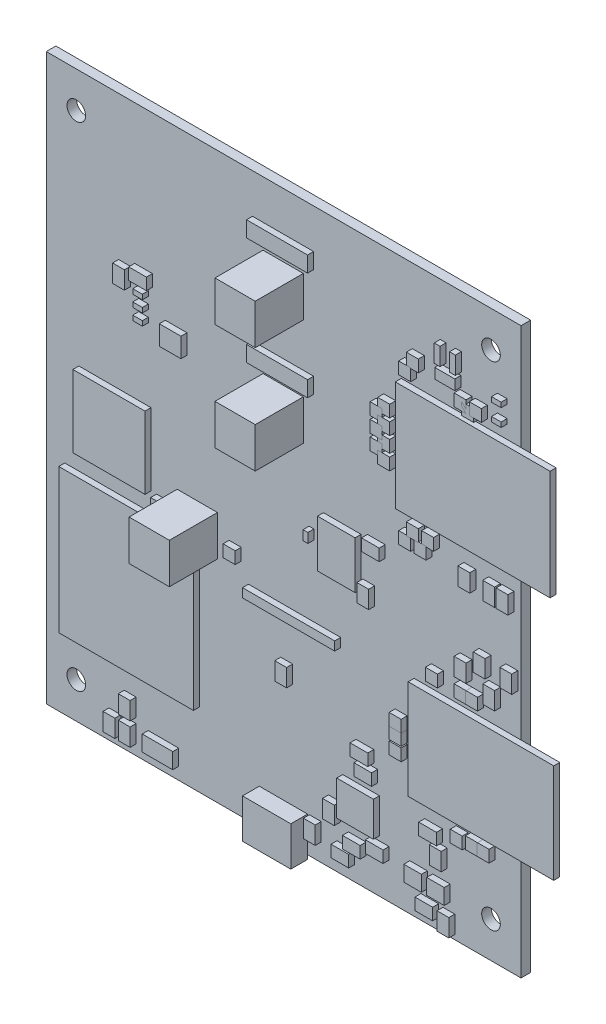
from build123d import *

# Parameters (mm, degrees)
SKETCH1_W                     = 79
SKETCH1_H                     = 94
BOARD_DEPTH                   = 1.6
SKETCH2_W                     = 22.4041
SKETCH2_H                     = 23.9616
BATTCOM_20MM_PTH_KIT_1_DEPTH  = 1
SKETCH3_W                     = 1.6
SKETCH3_H                     = 0.8008
C0603K_1_DEPTH                = 1
SKETCH4_W                     = 0.8008
SKETCH4_H                     = 1.6
C0603K_2_DEPTH                = 1
SKETCH5_W                     = 0.8008
SKETCH5_H                     = 1.6
C0603K_3_DEPTH                = 1
SKETCH6_W                     = 0.8008
SKETCH6_H                     = 1.6
C0603K_4_DEPTH                = 1
SKETCH7_W                     = 0.8008
SKETCH7_H                     = 1.6
C0603K_5_DEPTH                = 1
SKETCH8_W                     = 1.6
SKETCH8_H                     = 0.8008
C0603K_6_DEPTH                = 1
SKETCH9_W                     = 0.966
SKETCH9_H                     = 2.946
EXTRUDE_C0402_1_DEPTH         = 1
SKETCH10_W                    = 0.966
SKETCH10_H                    = 2.946
EXTRUDE_C0402_2_DEPTH         = 1
SKETCH11_W                    = 1.6
SKETCH11_H                    = 0.8008
C0603K_7_DEPTH                = 1
SKETCH12_W                    = 0.8008
SKETCH12_H                    = 1.6
C0603K_8_DEPTH                = 1
SKETCH13_W                    = 0.8008
SKETCH13_H                    = 1.6
C0603K_9_DEPTH                = 1
SKETCH14_W                    = 0.8008
SKETCH14_H                    = 1.6
C0603K_10_DEPTH               = 1
SKETCH15_W                    = 1.6
SKETCH15_H                    = 0.8008
C0603K_11_DEPTH               = 1
SKETCH16_W                    = 6.7016
SKETCH16_H                    = 6.7016
F_153CLV_0605_1_DEPTH         = 8
SKETCH17_W                    = 6.7016
SKETCH17_H                    = 6.7016
F_153CLV_0605_2_DEPTH         = 8
SKETCH18_W                    = 1.6
SKETCH18_H                    = 0.8008
C0603K_12_DEPTH               = 1
SKETCH19_W                    = 0.8008
SKETCH19_H                    = 1.6
C0603K_13_DEPTH               = 1
SKETCH20_W                    = 0.8008
SKETCH20_H                    = 1.6
C0603K_14_DEPTH               = 1
SKETCH21_W                    = 1.6
SKETCH21_H                    = 0.8008
C0603K_15_DEPTH               = 1
SKETCH22_W                    = 0.8008
SKETCH22_H                    = 1.6
C0603K_16_DEPTH               = 1
SKETCH23_W                    = 1.6
SKETCH23_H                    = 0.8008
C0603K_17_DEPTH               = 1
SKETCH24_W                    = 0.8008
SKETCH24_H                    = 1.6
C0603K_18_DEPTH               = 1
SKETCH25_W                    = 6.7016
SKETCH25_H                    = 6.7016
F_153CLV_0605_3_DEPTH         = 8
SKETCH26_W                    = 1.6
SKETCH26_H                    = 0.8008
C0603K_19_DEPTH               = 1
SKETCH27_W                    = 1.6
SKETCH27_H                    = 0.8008
C0603K_20_DEPTH               = 1
SKETCH28_W                    = 1.6
SKETCH28_H                    = 0.8008
C0603K_21_DEPTH               = 1
SKETCH29_W                    = 1.6
SKETCH29_H                    = 0.8008
C0603K_22_DEPTH               = 1
SKETCH30_W                    = 1.6
SKETCH30_H                    = 0.8008
C0603K_23_DEPTH               = 1
SKETCH31_W                    = 0.966
SKETCH31_H                    = 2.946
EXTRUDE_C0402_3_DEPTH         = 1
SKETCH32_W                    = 0.966
SKETCH32_H                    = 2.946
EXTRUDE_C0402_4_DEPTH         = 1
SKETCH33_W                    = 0.8008
SKETCH33_H                    = 1.6
C0603K_24_DEPTH               = 1
SKETCH34_W                    = 5.6242
SKETCH34_H                    = 5.676903
WS2812B_1_DEPTH               = 1
SKETCH35_W                    = 2.921
SKETCH35_H                    = 2.5908
SOT23_1_DEPTH                 = 1
SKETCH36_W                    = 2.921
SKETCH36_H                    = 2.5908
SOT23_2_DEPTH                 = 1
SKETCH37_W                    = 6.10435
SKETCH37_H                    = 5.77935
MLP28_1_DEPTH                 = 1
SKETCH38_W                    = 2.2
SKETCH38_H                    = 2.4032
SC70_5L_1_DEPTH               = 1
SKETCH39_W                    = 15.3416
SKETCH39_H                    = 1.4732
F_1X06_LONGPADS_1_DEPTH       = 1
SKETCH40_W                    = 8.04
SKETCH40_H                    = 6.534
USB_MICROB_PTH_MILL_1_DEPTH   = 2.8
SKETCH41_W                    = 2.9914
SKETCH41_H                    = 4.9968
L3225M_1_DEPTH                = 1
SKETCH42_W                    = 10.16
SKETCH42_H                    = 2.6162
EXTRUDE_1X04_1_DEPTH          = 1
SKETCH43_W                    = 10.16
SKETCH43_H                    = 2.6162
EXTRUDE_1X04_2_DEPTH          = 1
SKETCH44_W                    = 5.08
SKETCH44_H                    = 2.6162
EXTRUDE_1X02_1_DEPTH          = 1
SKETCH45_W                    = 12.0032
SKETCH45_H                    = 12.0032
BUZZER_12MM_NS_KIT_1_DEPTH    = 1
SKETCH46_W                    = 1.966
SKETCH46_H                    = 2.946
EXTRUDE_R0603_1_DEPTH         = 1
SKETCH47_W                    = 2.946
SKETCH47_H                    = 1.966
EXTRUDE_R0603_2_DEPTH         = 1
SKETCH48_W                    = 2.946
SKETCH48_H                    = 1.966
EXTRUDE_R0603_3_DEPTH         = 1
SKETCH49_W                    = 2.946
SKETCH49_H                    = 1.966
EXTRUDE_R0603_4_DEPTH         = 1
SKETCH50_W                    = 2.946
SKETCH50_H                    = 1.966
EXTRUDE_R0603_5_DEPTH         = 1
SKETCH51_W                    = 2.946
SKETCH51_H                    = 1.966
EXTRUDE_R0603_6_DEPTH         = 1
SKETCH52_W                    = 2.946
SKETCH52_H                    = 1.966
EXTRUDE_R0603_7_DEPTH         = 1
SKETCH53_W                    = 1.966
SKETCH53_H                    = 2.946
EXTRUDE_R0603_8_DEPTH         = 1
SKETCH54_W                    = 1.966
SKETCH54_H                    = 2.946
EXTRUDE_R0603_9_DEPTH         = 1
SKETCH55_W                    = 2.946
SKETCH55_H                    = 1.966
EXTRUDE_R0603_10_DEPTH        = 1
SKETCH56_W                    = 1.966
SKETCH56_H                    = 2.946
EXTRUDE_R0603_11_DEPTH        = 1
SKETCH57_W                    = 1.966
SKETCH57_H                    = 2.946
EXTRUDE_R0603_12_DEPTH        = 1
SKETCH58_W                    = 1.966
SKETCH58_H                    = 2.946
EXTRUDE_R0603_13_DEPTH        = 1
SKETCH59_W                    = 1.966
SKETCH59_H                    = 2.946
EXTRUDE_R0603_14_DEPTH        = 1
SKETCH60_W                    = 1.966
SKETCH60_H                    = 2.946
EXTRUDE_R0603_15_DEPTH        = 1
SKETCH61_W                    = 2.946
SKETCH61_H                    = 1.966
EXTRUDE_R0603_16_DEPTH        = 1
SKETCH62_W                    = 2.946
SKETCH62_H                    = 1.966
EXTRUDE_R0603_17_DEPTH        = 1
SKETCH63_W                    = 1.966
SKETCH63_H                    = 2.946
EXTRUDE_R0603_18_DEPTH        = 1
SKETCH64_W                    = 1.966
SKETCH64_H                    = 2.946
EXTRUDE_R0603_19_DEPTH        = 1
SKETCH65_W                    = 1.966
SKETCH65_H                    = 2.946
EXTRUDE_R0603_20_DEPTH        = 1
SKETCH66_W                    = 1.966
SKETCH66_H                    = 2.946
EXTRUDE_R0603_21_DEPTH        = 1
SKETCH67_W                    = 1.966
SKETCH67_H                    = 2.946
EXTRUDE_R0603_22_DEPTH        = 1
SKETCH68_W                    = 1.966
SKETCH68_H                    = 2.946
EXTRUDE_R0603_23_DEPTH        = 1
SKETCH69_W                    = 1.966
SKETCH69_H                    = 2.946
EXTRUDE_R0603_24_DEPTH        = 1
SKETCH70_W                    = 1.966
SKETCH70_H                    = 2.946
EXTRUDE_R0603_25_DEPTH        = 1
SKETCH71_W                    = 1.966
SKETCH71_H                    = 2.946
EXTRUDE_R0603_26_DEPTH        = 1
SKETCH72_W                    = 2.946
SKETCH72_H                    = 1.966
EXTRUDE_R0603_27_DEPTH        = 1
SKETCH73_W                    = 2.946
SKETCH73_H                    = 1.966
EXTRUDE_R0603_28_DEPTH        = 1
SKETCH74_W                    = 2.946
SKETCH74_H                    = 1.966
EXTRUDE_R0603_29_DEPTH        = 1
SKETCH75_W                    = 2.946
SKETCH75_H                    = 1.966
EXTRUDE_R0603_30_DEPTH        = 1
SKETCH76_W                    = 1.966
SKETCH76_H                    = 2.946
EXTRUDE_R0603_31_DEPTH        = 1
SKETCH77_W                    = 2.946
SKETCH77_H                    = 1.966
EXTRUDE_R0603_32_DEPTH        = 1
SKETCH78_W                    = 2.946
SKETCH78_H                    = 1.966
EXTRUDE_R0603_33_DEPTH        = 1
SKETCH79_W                    = 1.966
SKETCH79_H                    = 2.946
EXTRUDE_R0603_34_DEPTH        = 1
SKETCH80_W                    = 1.966
SKETCH80_H                    = 2.946
EXTRUDE_R0603_35_DEPTH        = 1
SKETCH81_W                    = 2.946
SKETCH81_H                    = 1.966
EXTRUDE_R0603_36_DEPTH        = 1
SKETCH82_W                    = 1.966
SKETCH82_H                    = 2.946
EXTRUDE_R0603_37_DEPTH        = 1
SKETCH83_W                    = 1.966
SKETCH83_H                    = 2.946
EXTRUDE_R0603_38_DEPTH        = 1
SKETCH84_W                    = 2.946
SKETCH84_H                    = 1.966
EXTRUDE_R0603_39_DEPTH        = 1
SKETCH85_W                    = 2.946
SKETCH85_H                    = 1.966
EXTRUDE_R0603_40_DEPTH        = 1
SKETCH86_W                    = 1.966
SKETCH86_H                    = 2.946
EXTRUDE_R0603_41_DEPTH        = 1
SKETCH87_W                    = 1.966
SKETCH87_H                    = 2.946
EXTRUDE_R0603_42_DEPTH        = 1
SKETCH88_W                    = 2.946
SKETCH88_H                    = 1.966
EXTRUDE_R0603_43_DEPTH        = 1
SKETCH89_W                    = 2.946
SKETCH89_H                    = 1.966
EXTRUDE_R0603_44_DEPTH        = 1
SKETCH90_W                    = 1.966
SKETCH90_H                    = 2.946
EXTRUDE_R0603_45_DEPTH        = 1
SKETCH91_W                    = 2.946
SKETCH91_H                    = 1.966
EXTRUDE_R0603_46_DEPTH        = 1
SKETCH92_W                    = 2.946
SKETCH92_H                    = 1.966
EXTRUDE_R0603_47_DEPTH        = 1
SKETCH93_W                    = 2.946
SKETCH93_H                    = 1.966
EXTRUDE_R0603_48_DEPTH        = 1
SKETCH94_W                    = 1.966
SKETCH94_H                    = 2.946
EXTRUDE_R0603_49_DEPTH        = 1
SKETCH95_W                    = 1.966
SKETCH95_H                    = 2.946
EXTRUDE_R0603_50_DEPTH        = 1
SKETCH96_W                    = 1.966
SKETCH96_H                    = 2.946
EXTRUDE_R0603_51_DEPTH        = 1
SKETCH97_W                    = 1.966
SKETCH97_H                    = 2.946
EXTRUDE_R0603_52_DEPTH        = 1
SKETCH98_W                    = 1.966
SKETCH98_H                    = 2.946
EXTRUDE_R0603_53_DEPTH        = 1
SKETCH99_W                    = 1.966
SKETCH99_H                    = 2.946
EXTRUDE_R0603_54_DEPTH        = 1
SKETCH100_W                   = 24.227
SKETCH100_H                   = 16.51
ESP8266_ESP12E_1_DEPTH        = 1
SKETCH101_W                   = 2.921
SKETCH101_H                   = 2.5908
SOT23_3_DEPTH                 = 1
SKETCH102_W                   = 2.921
SKETCH102_H                   = 2.5908
SOT23_4_DEPTH                 = 1
SKETCH103_W                   = 2.921
SKETCH103_H                   = 2.5908
SOT23_5_DEPTH                 = 1
SKETCH104_W                   = 2
SKETCH104_H                   = 2
TP10R_1_DEPTH                 = 1
SKETCH105_W                   = 2
SKETCH105_H                   = 2
TP10R_2_DEPTH                 = 1
SKETCH106_W                   = 2
SKETCH106_H                   = 2
TP10R_3_DEPTH                 = 1
SKETCH107_W                   = 2
SKETCH107_H                   = 2
TP10R_4_DEPTH                 = 1
SKETCH108_W                   = 2
SKETCH108_H                   = 2
TP10R_5_DEPTH                 = 1
SKETCH109_W                   = 2
SKETCH109_H                   = 2
TP10R_6_DEPTH                 = 1
SKETCH110_W                   = 2
SKETCH110_H                   = 2
TP10R_7_DEPTH                 = 1
SKETCH111_W                   = 2
SKETCH111_H                   = 2
TP10R_8_DEPTH                 = 1
SKETCH112_W                   = 2
SKETCH112_H                   = 2
TP10R_9_DEPTH                 = 1
SKETCH113_W                   = 2
SKETCH113_H                   = 2
TP10R_10_DEPTH                = 1
SKETCH114_W                   = 2
SKETCH114_H                   = 2
TP10R_11_DEPTH                = 1
SKETCH115_W                   = 2
SKETCH115_H                   = 2
TP10R_12_DEPTH                = 1
SKETCH116_W                   = 2
SKETCH116_H                   = 2
TP10R_13_DEPTH                = 1
SKETCH117_W                   = 2
SKETCH117_H                   = 2
TP10R_14_DEPTH                = 1
SKETCH118_W                   = 2
SKETCH118_H                   = 2
TP10R_15_DEPTH                = 1
SKETCH119_W                   = 2
SKETCH119_H                   = 2
TP10R_16_DEPTH                = 1
SKETCH120_W                   = 2
SKETCH120_H                   = 2
TP10R_17_DEPTH                = 1
SKETCH121_W                   = 2
SKETCH121_H                   = 2
TP10R_18_DEPTH                = 1
SKETCH122_W                   = 2
SKETCH122_H                   = 2
TP10R_19_DEPTH                = 1
SKETCH123_W                   = 2
SKETCH123_H                   = 2
TP10R_20_DEPTH                = 1
SKETCH124_W                   = 2
SKETCH124_H                   = 2
TP10R_21_DEPTH                = 1
SKETCH125_W                   = 2
SKETCH125_H                   = 2
TP10R_22_DEPTH                = 1
SKETCH126_W                   = 2
SKETCH126_H                   = 2
TP10R_23_DEPTH                = 1
SKETCH127_W                   = 2
SKETCH127_H                   = 2
TP10R_24_DEPTH                = 1
SKETCH128_W                   = 2
SKETCH128_H                   = 2
TP10R_25_DEPTH                = 1
SKETCH129_W                   = 2
SKETCH129_H                   = 2
TP10R_26_DEPTH                = 1
SKETCH130_W                   = 2
SKETCH130_H                   = 2
TP10R_27_DEPTH                = 1
SKETCH131_W                   = 3
SKETCH131_H                   = 2.9464
SOT23_5_1_DEPTH               = 1
SKETCH132_W                   = 5.715
SKETCH132_H                   = 6.1976
SO08_0_15_1_DEPTH             = 1
SKETCH133_W                   = 25.754
SKETCH133_H                   = 18.254
ESP_WROOM_32_1_DEPTH          = 1
SKETCH134_W                   = 11.230556
SKETCH134_H                   = 6.6675
SO016_1_DEPTH                 = 1
SKETCH135_W                   = 6.261
SKETCH135_H                   = 7.9
SOIC_8_1_DEPTH                = 1
SKETCH136_W                   = 3.5889
SKETCH136_H                   = 3.2524
QFN_16_0_5MM_EXTRA_1_DEPTH    = 1
SKETCH137_W                   = 6.096
SKETCH137_H                   = 13.208
HC49UP_1_DEPTH                = 1
SKETCH138_W                   = 3.327
SKETCH138_H                   = 1.7
CRYSTAL_SMD_3_2X1_5MM_1_DEPTH = 1
SKETCH139_W                   = 3.327
SKETCH139_H                   = 1.7
CRYSTAL_SMD_3_2X1_5MM_2_DEPTH = 1
SKETCH140_R                   = 1.55
CUT_EXTRUDE1_DEPTH            = 10


with BuildPart() as part:
    # Sketch1 → BOARD (new body)
    with BuildSketch(Plane.XY):
        with Locations((39.5, 47)):
            Rectangle(SKETCH1_W, SKETCH1_H)
    extrude(amount=BOARD_DEPTH)

    # Sketch140 → Cut-Extrude1 (cut)
    with BuildSketch(Plane.XY.offset(1.6)):
        with Locations((5, 6)):
            Circle(SKETCH140_R)
        with Locations((5, 88)):
            Circle(SKETCH140_R)
        with Locations((74, 6)):
            Circle(SKETCH140_R)
        with Locations((74, 88)):
            Circle(SKETCH140_R)
    extrude(amount=-CUT_EXTRUDE1_DEPTH, mode=Mode.SUBTRACT)


with BuildPart() as body_2:
    # Sketch2 → BATTCOM_20MM_PTH_KIT-1 (new body)
    with BuildSketch(Plane.XY.offset(1.6)):
        with Locations((14.2875, 24.2767)):
            Rectangle(SKETCH2_W, SKETCH2_H)
    extrude(amount=BATTCOM_20MM_PTH_KIT_1_DEPTH)


with BuildPart() as body_3:
    # Sketch3 → C0603K-1 (new body)
    with BuildSketch(Plane.XY):
        with Locations((38.1, 43.1804)):
            Rectangle(SKETCH3_W, SKETCH3_H)
    extrude(amount=-C0603K_1_DEPTH)


with BuildPart() as body_4:
    # Sketch4 → C0603K-2 (new body)
    with BuildSketch(Plane.XY):
        with Locations((34.9254, 24.765)):
            Rectangle(SKETCH4_W, SKETCH4_H)
    extrude(amount=-C0603K_2_DEPTH)


with BuildPart() as body_5:
    # Sketch5 → C0603K-3 (new body)
    with BuildSketch(Plane.XY):
        with Locations((37.1479, 24.765)):
            Rectangle(SKETCH5_W, SKETCH5_H)
    extrude(amount=-C0603K_3_DEPTH)


with BuildPart() as body_6:
    # Sketch6 → C0603K-4 (new body)
    with BuildSketch(Plane.XY):
        with Locations((39.6879, 24.765)):
            Rectangle(SKETCH6_W, SKETCH6_H)
    extrude(amount=-C0603K_4_DEPTH)


with BuildPart() as body_7:
    # Sketch7 → C0603K-5 (new body)
    with BuildSketch(Plane.XY):
        with Locations((41.9104, 24.765)):
            Rectangle(SKETCH7_W, SKETCH7_H)
    extrude(amount=-C0603K_5_DEPTH)


with BuildPart() as body_8:
    # Sketch8 → C0603K-6 (new body)
    with BuildSketch(Plane.XY):
        with Locations((39.37, 88.8996)):
            Rectangle(SKETCH8_W, SKETCH8_H)
    extrude(amount=-C0603K_6_DEPTH)


with BuildPart() as body_9:
    # Sketch9 → Extrude C0402-1 (new body)
    with BuildSketch(Plane.XY):
        with Locations((27.94, 10.4775)):
            Rectangle(SKETCH9_W, SKETCH9_H)
    extrude(amount=-EXTRUDE_C0402_1_DEPTH)


with BuildPart() as body_10:
    # Sketch10 → Extrude C0402-2 (new body)
    with BuildSketch(Plane.XY):
        with Locations((27.94, 18.7325)):
            Rectangle(SKETCH10_W, SKETCH10_H)
    extrude(amount=-EXTRUDE_C0402_2_DEPTH)


with BuildPart() as body_11:
    # Sketch11 → C0603K-7 (new body)
    with BuildSketch(Plane.XY):
        with Locations((39.37, 71.4371)):
            Rectangle(SKETCH11_W, SKETCH11_H)
    extrude(amount=-C0603K_7_DEPTH)


with BuildPart() as body_12:
    # Sketch12 → C0603K-8 (new body)
    with BuildSketch(Plane.XY):
        with Locations((19.3671, 22.5425)):
            Rectangle(SKETCH12_W, SKETCH12_H)
    extrude(amount=-C0603K_8_DEPTH)


with BuildPart() as body_13:
    # Sketch13 → C0603K-9 (new body)
    with BuildSketch(Plane.XY):
        with Locations((65.4046, 29.5275)):
            Rectangle(SKETCH13_W, SKETCH13_H)
    extrude(amount=-C0603K_9_DEPTH)


with BuildPart() as body_14:
    # Sketch14 → C0603K-10 (new body)
    with BuildSketch(Plane.XY):
        with Locations((67.3096, 29.5275)):
            Rectangle(SKETCH14_W, SKETCH14_H)
    extrude(amount=-C0603K_10_DEPTH)


with BuildPart() as body_15:
    # Sketch15 → C0603K-11 (new body)
    with BuildSketch(Plane.XY):
        with Locations((44.1325, 13.3346)):
            Rectangle(SKETCH15_W, SKETCH15_H)
    extrude(amount=-C0603K_11_DEPTH)


with BuildPart() as body_16:
    # Sketch16 → 153CLV-0605-1 (new body)
    with BuildSketch(Plane.XY.offset(1.6)):
        with Locations((39.4208, 62.2808)):
            Rectangle(SKETCH16_W, SKETCH16_H)
    extrude(amount=F_153CLV_0605_1_DEPTH)


with BuildPart() as body_17:
    # Sketch17 → 153CLV-0605-2 (new body)
    with BuildSketch(Plane.XY.offset(1.6)):
        with Locations((39.4208, 80.0608)):
            Rectangle(SKETCH17_W, SKETCH17_H)
    extrude(amount=F_153CLV_0605_2_DEPTH)


with BuildPart() as body_18:
    # Sketch18 → C0603K-12 (new body)
    with BuildSketch(Plane.XY):
        with Locations((66.9925, 21.9079)):
            Rectangle(SKETCH18_W, SKETCH18_H)
    extrude(amount=-C0603K_12_DEPTH)


with BuildPart() as body_19:
    # Sketch19 → C0603K-13 (new body)
    with BuildSketch(Plane.XY.offset(1.6)):
        with Locations((44.1321, 46.6725)):
            Rectangle(SKETCH19_W, SKETCH19_H)
    extrude(amount=C0603K_13_DEPTH)


with BuildPart() as body_20:
    # Sketch20 → C0603K-14 (new body)
    with BuildSketch(Plane.XY):
        with Locations((5.7154, 55.245)):
            Rectangle(SKETCH20_W, SKETCH20_H)
    extrude(amount=-C0603K_14_DEPTH)


with BuildPart() as body_21:
    # Sketch21 → C0603K-15 (new body)
    with BuildSketch(Plane.XY):
        with Locations((6.985, 58.1029)):
            Rectangle(SKETCH21_W, SKETCH21_H)
    extrude(amount=-C0603K_15_DEPTH)


with BuildPart() as body_22:
    # Sketch22 → C0603K-16 (new body)
    with BuildSketch(Plane.XY):
        with Locations((14.6054, 53.34)):
            Rectangle(SKETCH22_W, SKETCH22_H)
    extrude(amount=-C0603K_16_DEPTH)


with BuildPart() as body_23:
    # Sketch23 → C0603K-17 (new body)
    with BuildSketch(Plane.XY):
        with Locations((25.0825, 39.6871)):
            Rectangle(SKETCH23_W, SKETCH23_H)
    extrude(amount=-C0603K_17_DEPTH)


with BuildPart() as body_24:
    # Sketch24 → C0603K-18 (new body)
    with BuildSketch(Plane.XY):
        with Locations((28.2571, 42.2275)):
            Rectangle(SKETCH24_W, SKETCH24_H)
    extrude(amount=-C0603K_18_DEPTH)


with BuildPart() as body_25:
    # Sketch25 → 153CLV-0605-3 (new body)
    with BuildSketch(Plane.XY.offset(1.6)):
        with Locations((25.1333, 38.4683)):
            Rectangle(SKETCH25_W, SKETCH25_H)
    extrude(amount=F_153CLV_0605_3_DEPTH)


with BuildPart() as body_26:
    # Sketch26 → C0603K-19 (new body)
    with BuildSketch(Plane.XY.offset(1.6)):
        with Locations((75.8825, 79.0579)):
            Rectangle(SKETCH26_W, SKETCH26_H)
    extrude(amount=C0603K_19_DEPTH)


with BuildPart() as body_27:
    # Sketch27 → C0603K-20 (new body)
    with BuildSketch(Plane.XY.offset(1.6)):
        with Locations((75.8825, 81.9154)):
            Rectangle(SKETCH27_W, SKETCH27_H)
    extrude(amount=C0603K_20_DEPTH)


with BuildPart() as body_28:
    # Sketch28 → C0603K-21 (new body)
    with BuildSketch(Plane.XY.offset(1.6)):
        with Locations((16.1925, 63.8171)):
            Rectangle(SKETCH28_W, SKETCH28_H)
    extrude(amount=C0603K_21_DEPTH)


with BuildPart() as body_29:
    # Sketch29 → C0603K-22 (new body)
    with BuildSketch(Plane.XY.offset(1.6)):
        with Locations((16.1925, 65.7221)):
            Rectangle(SKETCH29_W, SKETCH29_H)
    extrude(amount=C0603K_22_DEPTH)


with BuildPart() as body_30:
    # Sketch30 → C0603K-23 (new body)
    with BuildSketch(Plane.XY.offset(1.6)):
        with Locations((16.1925, 67.6271)):
            Rectangle(SKETCH30_W, SKETCH30_H)
    extrude(amount=C0603K_23_DEPTH)


with BuildPart() as body_31:
    # Sketch31 → Extrude C0402-3 (new body)
    with BuildSketch(Plane.XY.offset(1.6)):
        with Locations((66.04, 83.82)):
            Rectangle(SKETCH31_W, SKETCH31_H)
    extrude(amount=EXTRUDE_C0402_3_DEPTH)


with BuildPart() as body_32:
    # Sketch32 → Extrude C0402-4 (new body)
    with BuildSketch(Plane.XY.offset(1.6)):
        with Locations((68.58, 83.82)):
            Rectangle(SKETCH32_W, SKETCH32_H)
    extrude(amount=EXTRUDE_C0402_4_DEPTH)


with BuildPart() as body_33:
    # Sketch33 → C0603K-24 (new body)
    with BuildSketch(Plane.XY):
        with Locations((66.0404, 25.0825)):
            Rectangle(SKETCH33_W, SKETCH33_H)
    extrude(amount=-C0603K_24_DEPTH)


with BuildPart() as body_34:
    # Sketch34 → WS2812B-1 (new body)
    with BuildSketch(Plane.XY):
        with Locations((39.6186, 47.2122485)):
            Rectangle(SKETCH34_W, SKETCH34_H)
    extrude(amount=-WS2812B_1_DEPTH)


with BuildPart() as body_35:
    # Sketch35 → SOT23-1 (new body)
    with BuildSketch(Plane.XY):
        with Locations((39.3319, 40.3225)):
            Rectangle(SKETCH35_W, SKETCH35_H)
    extrude(amount=-SOT23_1_DEPTH)


with BuildPart() as body_36:
    # Sketch36 → SOT23-2 (new body)
    with BuildSketch(Plane.XY):
        with Locations((47.0281, 22.86)):
            Rectangle(SKETCH36_W, SKETCH36_H)
    extrude(amount=-SOT23_2_DEPTH)


with BuildPart() as body_37:
    # Sketch37 → MLP28-1 (new body)
    with BuildSketch(Plane.XY.offset(1.6)):
        with Locations((52.385325, 11.594675)):
            Rectangle(SKETCH37_W, SKETCH37_H)
    extrude(amount=MLP28_1_DEPTH)


with BuildPart() as body_38:
    # Sketch38 → SC70-5L-1 (new body)
    with BuildSketch(Plane.XY):
        with Locations((11.43, 53.34)):
            Rectangle(SKETCH38_W, SKETCH38_H)
    extrude(amount=-SC70_5L_1_DEPTH)


with BuildPart() as body_39:
    # Sketch39 → 1X06_LONGPADS-1 (new body)
    with BuildSketch(Plane.XY.offset(1.6)):
        with Locations((41.3258, 33.3375)):
            Rectangle(SKETCH39_W, SKETCH39_H)
    extrude(amount=F_1X06_LONGPADS_1_DEPTH)


with BuildPart() as body_40:
    # Sketch40 → USB-MICROB-PTH-MILL-1 (new body)
    with BuildSketch(Plane.XY.offset(1.6)):
        with Locations((39.468428, 2.596341)):
            Rectangle(SKETCH40_W, SKETCH40_H)
    extrude(amount=USB_MICROB_PTH_MILL_1_DEPTH)


with BuildPart() as body_41:
    # Sketch41 → L3225M-1 (new body)
    with BuildSketch(Plane.XY):
        with Locations((20.6248, 42.2275)):
            Rectangle(SKETCH41_W, SKETCH41_H)
    extrude(amount=-L3225M_1_DEPTH)


with BuildPart() as body_42:
    # Sketch42 → Extrude 1X04-1 (new body)
    with BuildSketch(Plane.XY.offset(1.6)):
        with Locations((39.403706, 68.150384)):
            Rectangle(SKETCH42_W, SKETCH42_H)
    extrude(amount=EXTRUDE_1X04_1_DEPTH)


with BuildPart() as body_43:
    # Sketch43 → Extrude 1X04-2 (new body)
    with BuildSketch(Plane.XY.offset(1.6)):
        with Locations((39.403159, 86.1172)):
            Rectangle(SKETCH43_W, SKETCH43_H)
    extrude(amount=EXTRUDE_1X04_2_DEPTH)


with BuildPart() as body_44:
    # Sketch44 → Extrude 1X02-1 (new body)
    with BuildSketch(Plane.XY.offset(1.6)):
        with Locations((19.502516, 3.337603)):
            Rectangle(SKETCH44_W, SKETCH44_H)
    extrude(amount=EXTRUDE_1X02_1_DEPTH)


with BuildPart() as body_45:
    # Sketch45 → BUZZER-12MM-NS-KIT-1 (new body)
    with BuildSketch(Plane.XY.offset(1.6)):
        with Locations((11.43, 45.4025)):
            Rectangle(SKETCH45_W, SKETCH45_H)
    extrude(amount=BUZZER_12MM_NS_KIT_1_DEPTH)


with BuildPart() as body_46:
    # Sketch46 → Extrude R0603-1 (new body)
    with BuildSketch(Plane.XY.offset(1.6)):
        with Locations((66.9925, 2.2225)):
            Rectangle(SKETCH46_W, SKETCH46_H)
    extrude(amount=EXTRUDE_R0603_1_DEPTH)


with BuildPart() as body_47:
    # Sketch47 → Extrude R0603-2 (new body)
    with BuildSketch(Plane.XY.offset(1.6)):
        with Locations((63.8175, 2.8575)):
            Rectangle(SKETCH47_W, SKETCH47_H)
    extrude(amount=EXTRUDE_R0603_2_DEPTH)


with BuildPart() as body_48:
    # Sketch48 → Extrude R0603-3 (new body)
    with BuildSketch(Plane.XY.offset(1.6)):
        with Locations((53.0225, 19.685)):
            Rectangle(SKETCH48_W, SKETCH48_H)
    extrude(amount=EXTRUDE_R0603_3_DEPTH)


with BuildPart() as body_49:
    # Sketch49 → Extrude R0603-4 (new body)
    with BuildSketch(Plane.XY.offset(1.6)):
        with Locations((53.6575, 17.145)):
            Rectangle(SKETCH49_W, SKETCH49_H)
    extrude(amount=EXTRUDE_R0603_4_DEPTH)


with BuildPart() as body_50:
    # Sketch50 → Extrude R0603-5 (new body)
    with BuildSketch(Plane.XY):
        with Locations((41.275, 11.43)):
            Rectangle(SKETCH50_W, SKETCH50_H)
    extrude(amount=-EXTRUDE_R0603_5_DEPTH)


with BuildPart() as body_51:
    # Sketch51 → Extrude R0603-6 (new body)
    with BuildSketch(Plane.XY):
        with Locations((37.1475, 11.43)):
            Rectangle(SKETCH51_W, SKETCH51_H)
    extrude(amount=-EXTRUDE_R0603_6_DEPTH)


with BuildPart() as body_52:
    # Sketch52 → Extrude R0603-7 (new body)
    with BuildSketch(Plane.XY):
        with Locations((47.9425, 17.145)):
            Rectangle(SKETCH52_W, SKETCH52_H)
    extrude(amount=-EXTRUDE_R0603_7_DEPTH)


with BuildPart() as body_53:
    # Sketch53 → Extrude R0603-8 (new body)
    with BuildSketch(Plane.XY):
        with Locations((40.3225, 12.3825)):
            Rectangle(SKETCH53_W, SKETCH53_H)
    extrude(amount=-EXTRUDE_R0603_8_DEPTH)


with BuildPart() as body_54:
    # Sketch54 → Extrude R0603-9 (new body)
    with BuildSketch(Plane.XY):
        with Locations((38.1, 12.3825)):
            Rectangle(SKETCH54_W, SKETCH54_H)
    extrude(amount=-EXTRUDE_R0603_9_DEPTH)


with BuildPart() as body_55:
    # Sketch55 → Extrude R0603-10 (new body)
    with BuildSketch(Plane.XY):
        with Locations((47.9425, 19.685)):
            Rectangle(SKETCH55_W, SKETCH55_H)
    extrude(amount=-EXTRUDE_R0603_10_DEPTH)


with BuildPart() as body_56:
    # Sketch56 → Extrude R0603-11 (new body)
    with BuildSketch(Plane.XY.offset(1.6)):
        with Locations((40.005, 24.765)):
            Rectangle(SKETCH56_W, SKETCH56_H)
    extrude(amount=EXTRUDE_R0603_11_DEPTH)


with BuildPart() as body_57:
    # Sketch57 → Extrude R0603-12 (new body)
    with BuildSketch(Plane.XY):
        with Locations((76.835, 22.86)):
            Rectangle(SKETCH57_W, SKETCH57_H)
    extrude(amount=-EXTRUDE_R0603_12_DEPTH)


with BuildPart() as body_58:
    # Sketch58 → Extrude R0603-13 (new body)
    with BuildSketch(Plane.XY):
        with Locations((74.295, 22.86)):
            Rectangle(SKETCH58_W, SKETCH58_H)
    extrude(amount=-EXTRUDE_R0603_13_DEPTH)


with BuildPart() as body_59:
    # Sketch59 → Extrude R0603-14 (new body)
    with BuildSketch(Plane.XY.offset(1.6)):
        with Locations((74.6125, 38.735)):
            Rectangle(SKETCH59_W, SKETCH59_H)
    extrude(amount=EXTRUDE_R0603_14_DEPTH)


with BuildPart() as body_60:
    # Sketch60 → Extrude R0603-15 (new body)
    with BuildSketch(Plane.XY):
        with Locations((68.2625, 25.0825)):
            Rectangle(SKETCH60_W, SKETCH60_H)
    extrude(amount=-EXTRUDE_R0603_15_DEPTH)


with BuildPart() as body_61:
    # Sketch61 → Extrude R0603-16 (new body)
    with BuildSketch(Plane.XY):
        with Locations((16.1925, 28.2575)):
            Rectangle(SKETCH61_W, SKETCH61_H)
    extrude(amount=-EXTRUDE_R0603_16_DEPTH)


with BuildPart() as body_62:
    # Sketch62 → Extrude R0603-17 (new body)
    with BuildSketch(Plane.XY.offset(1.6)):
        with Locations((54.9275, 50.165)):
            Rectangle(SKETCH62_W, SKETCH62_H)
    extrude(amount=EXTRUDE_R0603_17_DEPTH)


with BuildPart() as body_63:
    # Sketch63 → Extrude R0603-18 (new body)
    with BuildSketch(Plane.XY.offset(1.6)):
        with Locations((11.43, 3.175)):
            Rectangle(SKETCH63_W, SKETCH63_H)
    extrude(amount=EXTRUDE_R0603_18_DEPTH)


with BuildPart() as body_64:
    # Sketch64 → Extrude R0603-19 (new body)
    with BuildSketch(Plane.XY.offset(1.6)):
        with Locations((13.97, 6.985)):
            Rectangle(SKETCH64_W, SKETCH64_H)
    extrude(amount=EXTRUDE_R0603_19_DEPTH)


with BuildPart() as body_65:
    # Sketch65 → Extrude R0603-20 (new body)
    with BuildSketch(Plane.XY.offset(1.6)):
        with Locations((13.97, 3.175)):
            Rectangle(SKETCH65_W, SKETCH65_H)
    extrude(amount=EXTRUDE_R0603_20_DEPTH)


with BuildPart() as body_66:
    # Sketch66 → Extrude R0603-21 (new body)
    with BuildSketch(Plane.XY.offset(1.6)):
        with Locations((44.7675, 4.445)):
            Rectangle(SKETCH66_W, SKETCH66_H)
    extrude(amount=EXTRUDE_R0603_21_DEPTH)


with BuildPart() as body_67:
    # Sketch67 → Extrude R0603-22 (new body)
    with BuildSketch(Plane.XY):
        with Locations((36.5125, 40.005)):
            Rectangle(SKETCH67_W, SKETCH67_H)
    extrude(amount=-EXTRUDE_R0603_22_DEPTH)


with BuildPart() as body_68:
    # Sketch68 → Extrude R0603-23 (new body)
    with BuildSketch(Plane.XY):
        with Locations((36.83, 51.7525)):
            Rectangle(SKETCH68_W, SKETCH68_H)
    extrude(amount=-EXTRUDE_R0603_23_DEPTH)


with BuildPart() as body_69:
    # Sketch69 → Extrude R0603-24 (new body)
    with BuildSketch(Plane.XY):
        with Locations((39.37, 76.2)):
            Rectangle(SKETCH69_W, SKETCH69_H)
    extrude(amount=-EXTRUDE_R0603_24_DEPTH)


with BuildPart() as body_70:
    # Sketch70 → Extrude R0603-25 (new body)
    with BuildSketch(Plane.XY.offset(1.6)):
        with Locations((77.47, 42.545)):
            Rectangle(SKETCH70_W, SKETCH70_H)
    extrude(amount=EXTRUDE_R0603_25_DEPTH)


with BuildPart() as body_71:
    # Sketch71 → Extrude R0603-26 (new body)
    with BuildSketch(Plane.XY.offset(1.6)):
        with Locations((73.025, 42.545)):
            Rectangle(SKETCH71_W, SKETCH71_H)
    extrude(amount=EXTRUDE_R0603_26_DEPTH)


with BuildPart() as body_72:
    # Sketch72 → Extrude R0603-27 (new body)
    with BuildSketch(Plane.XY):
        with Locations((72.7075, 27.6225)):
            Rectangle(SKETCH72_W, SKETCH72_H)
    extrude(amount=-EXTRUDE_R0603_27_DEPTH)


with BuildPart() as body_73:
    # Sketch73 → Extrude R0603-28 (new body)
    with BuildSketch(Plane.XY):
        with Locations((68.2625, 33.02)):
            Rectangle(SKETCH73_W, SKETCH73_H)
    extrude(amount=-EXTRUDE_R0603_28_DEPTH)


with BuildPart() as body_74:
    # Sketch74 → Extrude R0603-29 (new body)
    with BuildSketch(Plane.XY):
        with Locations((72.7075, 30.1625)):
            Rectangle(SKETCH74_W, SKETCH74_H)
    extrude(amount=-EXTRUDE_R0603_29_DEPTH)


with BuildPart() as body_75:
    # Sketch75 → Extrude R0603-30 (new body)
    with BuildSketch(Plane.XY.offset(1.6)):
        with Locations((64.4525, 13.97)):
            Rectangle(SKETCH75_W, SKETCH75_H)
    extrude(amount=EXTRUDE_R0603_30_DEPTH)


with BuildPart() as body_76:
    # Sketch76 → Extrude R0603-31 (new body)
    with BuildSketch(Plane.XY.offset(1.6)):
        with Locations((69.85, 40.3225)):
            Rectangle(SKETCH76_W, SKETCH76_H)
    extrude(amount=EXTRUDE_R0603_31_DEPTH)


with BuildPart() as body_77:
    # Sketch77 → Extrude R0603-32 (new body)
    with BuildSketch(Plane.XY):
        with Locations((13.97, 50.165)):
            Rectangle(SKETCH77_W, SKETCH77_H)
    extrude(amount=-EXTRUDE_R0603_32_DEPTH)


with BuildPart() as body_78:
    # Sketch78 → Extrude R0603-33 (new body)
    with BuildSketch(Plane.XY):
        with Locations((6.985, 60.6425)):
            Rectangle(SKETCH78_W, SKETCH78_H)
    extrude(amount=-EXTRUDE_R0603_33_DEPTH)


with BuildPart() as body_79:
    # Sketch79 → Extrude R0603-34 (new body)
    with BuildSketch(Plane.XY):
        with Locations((10.795, 50.165)):
            Rectangle(SKETCH79_W, SKETCH79_H)
    extrude(amount=-EXTRUDE_R0603_34_DEPTH)


with BuildPart() as body_80:
    # Sketch80 → Extrude R0603-35 (new body)
    with BuildSketch(Plane.XY):
        with Locations((8.255, 52.07)):
            Rectangle(SKETCH80_W, SKETCH80_H)
    extrude(amount=-EXTRUDE_R0603_35_DEPTH)


with BuildPart() as body_81:
    # Sketch81 → Extrude R0603-36 (new body)
    with BuildSketch(Plane.XY):
        with Locations((11.43, 55.88)):
            Rectangle(SKETCH81_W, SKETCH81_H)
    extrude(amount=-EXTRUDE_R0603_36_DEPTH)


with BuildPart() as body_82:
    # Sketch82 → Extrude R0603-37 (new body)
    with BuildSketch(Plane.XY):
        with Locations((8.255, 55.245)):
            Rectangle(SKETCH82_W, SKETCH82_H)
    extrude(amount=-EXTRUDE_R0603_37_DEPTH)


with BuildPart() as body_83:
    # Sketch83 → Extrude R0603-38 (new body)
    with BuildSketch(Plane.XY):
        with Locations((8.255, 40.3225)):
            Rectangle(SKETCH83_W, SKETCH83_H)
    extrude(amount=-EXTRUDE_R0603_38_DEPTH)


with BuildPart() as body_84:
    # Sketch84 → Extrude R0603-39 (new body)
    with BuildSketch(Plane.XY):
        with Locations((8.89, 36.5125)):
            Rectangle(SKETCH84_W, SKETCH84_H)
    extrude(amount=-EXTRUDE_R0603_39_DEPTH)


with BuildPart() as body_85:
    # Sketch85 → Extrude R0603-40 (new body)
    with BuildSketch(Plane.XY.offset(1.6)):
        with Locations((55.5625, 6.985)):
            Rectangle(SKETCH85_W, SKETCH85_H)
    extrude(amount=EXTRUDE_R0603_40_DEPTH)


with BuildPart() as body_86:
    # Sketch86 → Extrude R0603-41 (new body)
    with BuildSketch(Plane.XY):
        with Locations((30.1625, 42.2275)):
            Rectangle(SKETCH86_W, SKETCH86_H)
    extrude(amount=-EXTRUDE_R0603_41_DEPTH)


with BuildPart() as body_87:
    # Sketch87 → Extrude R0603-42 (new body)
    with BuildSketch(Plane.XY.offset(1.6)):
        with Locations((47.9425, 8.89)):
            Rectangle(SKETCH87_W, SKETCH87_H)
    extrude(amount=EXTRUDE_R0603_42_DEPTH)


with BuildPart() as body_88:
    # Sketch88 → Extrude R0603-43 (new body)
    with BuildSketch(Plane.XY.offset(1.6)):
        with Locations((51.7525, 5.715)):
            Rectangle(SKETCH88_W, SKETCH88_H)
    extrude(amount=EXTRUDE_R0603_43_DEPTH)


with BuildPart() as body_89:
    # Sketch89 → Extrude R0603-44 (new body)
    with BuildSketch(Plane.XY.offset(1.6)):
        with Locations((49.8475, 3.4925)):
            Rectangle(SKETCH89_W, SKETCH89_H)
    extrude(amount=EXTRUDE_R0603_44_DEPTH)


with BuildPart() as body_90:
    # Sketch90 → Extrude R0603-45 (new body)
    with BuildSketch(Plane.XY.offset(1.6)):
        with Locations((13.0175, 68.58)):
            Rectangle(SKETCH90_W, SKETCH90_H)
    extrude(amount=EXTRUDE_R0603_45_DEPTH)


with BuildPart() as body_91:
    # Sketch91 → Extrude R0603-46 (new body)
    with BuildSketch(Plane.XY.offset(1.6)):
        with Locations((16.1925, 69.85)):
            Rectangle(SKETCH91_W, SKETCH91_H)
    extrude(amount=EXTRUDE_R0603_46_DEPTH)


with BuildPart() as body_92:
    # Sketch92 → Extrude R0603-47 (new body)
    with BuildSketch(Plane.XY):
        with Locations((63.8175, 64.135)):
            Rectangle(SKETCH92_W, SKETCH92_H)
    extrude(amount=-EXTRUDE_R0603_47_DEPTH)


with BuildPart() as body_93:
    # Sketch93 → Extrude R0603-48 (new body)
    with BuildSketch(Plane.XY):
        with Locations((63.8175, 61.595)):
            Rectangle(SKETCH93_W, SKETCH93_H)
    extrude(amount=-EXTRUDE_R0603_48_DEPTH)


with BuildPart() as body_94:
    # Sketch94 → Extrude R0603-49 (new body)
    with BuildSketch(Plane.XY):
        with Locations((66.9925, 61.9125)):
            Rectangle(SKETCH94_W, SKETCH94_H)
    extrude(amount=-EXTRUDE_R0603_49_DEPTH)


with BuildPart() as body_95:
    # Sketch95 → Extrude R0603-50 (new body)
    with BuildSketch(Plane.XY.offset(1.6)):
        with Locations((70.485, 53.6575)):
            Rectangle(SKETCH95_W, SKETCH95_H)
    extrude(amount=EXTRUDE_R0603_50_DEPTH)


with BuildPart() as body_96:
    # Sketch96 → Extrude R0603-51 (new body)
    with BuildSketch(Plane.XY.offset(1.6)):
        with Locations((74.6125, 53.6575)):
            Rectangle(SKETCH96_W, SKETCH96_H)
    extrude(amount=EXTRUDE_R0603_51_DEPTH)


with BuildPart() as body_97:
    # Sketch97 → Extrude R0603-52 (new body)
    with BuildSketch(Plane.XY.offset(1.6)):
        with Locations((76.835, 53.6575)):
            Rectangle(SKETCH97_W, SKETCH97_H)
    extrude(amount=EXTRUDE_R0603_52_DEPTH)


with BuildPart() as body_98:
    # Sketch98 → Extrude R0603-53 (new body)
    with BuildSketch(Plane.XY.offset(1.6)):
        with Locations((53.6575, 42.8625)):
            Rectangle(SKETCH98_W, SKETCH98_H)
    extrude(amount=EXTRUDE_R0603_53_DEPTH)


with BuildPart() as body_99:
    # Sketch99 → Extrude R0603-54 (new body)
    with BuildSketch(Plane.XY.offset(1.6)):
        with Locations((65.7225, 11.1125)):
            Rectangle(SKETCH99_W, SKETCH99_H)
    extrude(amount=EXTRUDE_R0603_54_DEPTH)


with BuildPart() as body_100:
    # Sketch100 → ESP8266-ESP12E-1 (new body)
    with BuildSketch(Plane.XY.offset(1.6)):
        with Locations((73.3275, 26.035)):
            Rectangle(SKETCH100_W, SKETCH100_H)
    extrude(amount=ESP8266_ESP12E_1_DEPTH)


with BuildPart() as body_101:
    # Sketch101 → SOT23-3 (new body)
    with BuildSketch(Plane.XY.offset(1.6)):
        with Locations((65.7606, 6.35)):
            Rectangle(SKETCH101_W, SKETCH101_H)
    extrude(amount=SOT23_3_DEPTH)


with BuildPart() as body_102:
    # Sketch102 → SOT23-4 (new body)
    with BuildSketch(Plane.XY.offset(1.6)):
        with Locations((61.9506, 6.35)):
            Rectangle(SKETCH102_W, SKETCH102_H)
    extrude(amount=SOT23_4_DEPTH)


with BuildPart() as body_103:
    # Sketch103 → SOT23-5 (new body)
    with BuildSketch(Plane.XY):
        with Locations((10.7569, 40.3225)):
            Rectangle(SKETCH103_W, SKETCH103_H)
    extrude(amount=-SOT23_5_DEPTH)


with BuildPart() as body_104:
    # Sketch104 → TP10R-1 (new body)
    with BuildSketch(Plane.XY.offset(1.6)):
        with Locations((71.755, 36.83)):
            Rectangle(SKETCH104_W, SKETCH104_H)
    extrude(amount=TP10R_1_DEPTH)


with BuildPart() as body_105:
    # Sketch105 → TP10R-2 (new body)
    with BuildSketch(Plane.XY.offset(1.6)):
        with Locations((73.66, 15.875)):
            Rectangle(SKETCH105_W, SKETCH105_H)
    extrude(amount=TP10R_2_DEPTH)


with BuildPart() as body_106:
    # Sketch106 → TP10R-3 (new body)
    with BuildSketch(Plane.XY.offset(1.6)):
        with Locations((69.85, 36.83)):
            Rectangle(SKETCH106_W, SKETCH106_H)
    extrude(amount=TP10R_3_DEPTH)


with BuildPart() as body_107:
    # Sketch107 → TP10R-4 (new body)
    with BuildSketch(Plane.XY.offset(1.6)):
        with Locations((65.0875, 36.83)):
            Rectangle(SKETCH107_W, SKETCH107_H)
    extrude(amount=TP10R_4_DEPTH)


with BuildPart() as body_108:
    # Sketch108 → TP10R-5 (new body)
    with BuildSketch(Plane.XY.offset(1.6)):
        with Locations((59.055, 23.1775)):
            Rectangle(SKETCH108_W, SKETCH108_H)
    extrude(amount=TP10R_5_DEPTH)


with BuildPart() as body_109:
    # Sketch109 → TP10R-6 (new body)
    with BuildSketch(Plane.XY.offset(1.6)):
        with Locations((69.215, 15.5575)):
            Rectangle(SKETCH109_W, SKETCH109_H)
    extrude(amount=TP10R_6_DEPTH)


with BuildPart() as body_110:
    # Sketch110 → TP10R-7 (new body)
    with BuildSketch(Plane.XY.offset(1.6)):
        with Locations((59.055, 27.305)):
            Rectangle(SKETCH110_W, SKETCH110_H)
    extrude(amount=TP10R_7_DEPTH)


with BuildPart() as body_111:
    # Sketch111 → TP10R-8 (new body)
    with BuildSketch(Plane.XY.offset(1.6)):
        with Locations((59.055, 25.4)):
            Rectangle(SKETCH111_W, SKETCH111_H)
    extrude(amount=TP10R_8_DEPTH)


with BuildPart() as body_112:
    # Sketch112 → TP10R-9 (new body)
    with BuildSketch(Plane.XY.offset(1.6)):
        with Locations((71.755, 15.875)):
            Rectangle(SKETCH112_W, SKETCH112_H)
    extrude(amount=TP10R_9_DEPTH)


with BuildPart() as body_113:
    # Sketch113 → TP10R-10 (new body)
    with BuildSketch(Plane.XY.offset(1.6)):
        with Locations((60.6425, 78.74)):
            Rectangle(SKETCH113_W, SKETCH113_H)
    extrude(amount=TP10R_10_DEPTH)


with BuildPart() as body_114:
    # Sketch114 → TP10R-11 (new body)
    with BuildSketch(Plane.XY.offset(1.6)):
        with Locations((19.3675, 38.4175)):
            Rectangle(SKETCH114_W, SKETCH114_H)
    extrude(amount=TP10R_11_DEPTH)


with BuildPart() as body_115:
    # Sketch115 → TP10R-12 (new body)
    with BuildSketch(Plane.XY.offset(1.6)):
        with Locations((57.15, 71.755)):
            Rectangle(SKETCH115_W, SKETCH115_H)
    extrude(amount=TP10R_12_DEPTH)


with BuildPart() as body_116:
    # Sketch116 → TP10R-13 (new body)
    with BuildSketch(Plane.XY.offset(1.6)):
        with Locations((31.4325, 37.7825)):
            Rectangle(SKETCH116_W, SKETCH116_H)
    extrude(amount=TP10R_13_DEPTH)


with BuildPart() as body_117:
    # Sketch117 → TP10R-14 (new body)
    with BuildSketch(Plane.XY.offset(1.6)):
        with Locations((69.85, 78.74)):
            Rectangle(SKETCH117_W, SKETCH117_H)
    extrude(amount=TP10R_14_DEPTH)


with BuildPart() as body_118:
    # Sketch118 → TP10R-15 (new body)
    with BuildSketch(Plane.XY.offset(1.6)):
        with Locations((71.12, 78.105)):
            Rectangle(SKETCH118_W, SKETCH118_H)
    extrude(amount=TP10R_15_DEPTH)


with BuildPart() as body_119:
    # Sketch119 → TP10R-16 (new body)
    with BuildSketch(Plane.XY.offset(1.6)):
        with Locations((72.39, 78.74)):
            Rectangle(SKETCH119_W, SKETCH119_H)
    extrude(amount=TP10R_16_DEPTH)


with BuildPart() as body_120:
    # Sketch120 → TP10R-17 (new body)
    with BuildSketch(Plane.XY.offset(1.6)):
        with Locations((61.9125, 56.1975)):
            Rectangle(SKETCH120_W, SKETCH120_H)
    extrude(amount=TP10R_17_DEPTH)


with BuildPart() as body_121:
    # Sketch121 → TP10R-18 (new body)
    with BuildSketch(Plane.XY.offset(1.6)):
        with Locations((55.88, 70.485)):
            Rectangle(SKETCH121_W, SKETCH121_H)
    extrude(amount=TP10R_18_DEPTH)


with BuildPart() as body_122:
    # Sketch122 → TP10R-19 (new body)
    with BuildSketch(Plane.XY.offset(1.6)):
        with Locations((57.15, 69.215)):
            Rectangle(SKETCH122_W, SKETCH122_H)
    extrude(amount=TP10R_19_DEPTH)


with BuildPart() as body_123:
    # Sketch123 → TP10R-20 (new body)
    with BuildSketch(Plane.XY.offset(1.6)):
        with Locations((55.88, 67.945)):
            Rectangle(SKETCH123_W, SKETCH123_H)
    extrude(amount=TP10R_20_DEPTH)


with BuildPart() as body_124:
    # Sketch124 → TP10R-21 (new body)
    with BuildSketch(Plane.XY.offset(1.6)):
        with Locations((57.15, 66.675)):
            Rectangle(SKETCH124_W, SKETCH124_H)
    extrude(amount=TP10R_21_DEPTH)


with BuildPart() as body_125:
    # Sketch125 → TP10R-22 (new body)
    with BuildSketch(Plane.XY.offset(1.6)):
        with Locations((55.88, 65.405)):
            Rectangle(SKETCH125_W, SKETCH125_H)
    extrude(amount=TP10R_22_DEPTH)


with BuildPart() as body_126:
    # Sketch126 → TP10R-23 (new body)
    with BuildSketch(Plane.XY.offset(1.6)):
        with Locations((57.15, 64.135)):
            Rectangle(SKETCH126_W, SKETCH126_H)
    extrude(amount=TP10R_23_DEPTH)


with BuildPart() as body_127:
    # Sketch127 → TP10R-24 (new body)
    with BuildSketch(Plane.XY.offset(1.6)):
        with Locations((61.9125, 80.645)):
            Rectangle(SKETCH127_W, SKETCH127_H)
    extrude(amount=TP10R_24_DEPTH)


with BuildPart() as body_128:
    # Sketch128 → TP10R-25 (new body)
    with BuildSketch(Plane.XY.offset(1.6)):
        with Locations((63.1825, 54.2925)):
            Rectangle(SKETCH128_W, SKETCH128_H)
    extrude(amount=TP10R_25_DEPTH)


with BuildPart() as body_129:
    # Sketch129 → TP10R-26 (new body)
    with BuildSketch(Plane.XY.offset(1.6)):
        with Locations((64.4525, 56.1975)):
            Rectangle(SKETCH129_W, SKETCH129_H)
    extrude(amount=TP10R_26_DEPTH)


with BuildPart() as body_130:
    # Sketch130 → TP10R-27 (new body)
    with BuildSketch(Plane.XY.offset(1.6)):
        with Locations((60.6425, 54.2925)):
            Rectangle(SKETCH130_W, SKETCH130_H)
    extrude(amount=TP10R_27_DEPTH)


with BuildPart() as body_131:
    # Sketch131 → SOT23-5-1 (new body)
    with BuildSketch(Plane.XY):
        with Locations((25.0825, 42.1767)):
            Rectangle(SKETCH131_W, SKETCH131_H)
    extrude(amount=-SOT23_5_1_DEPTH)


with BuildPart() as body_132:
    # Sketch132 → SO08-0_15-1 (new body)
    with BuildSketch(Plane.XY):
        with Locations((15.24, 22.5425)):
            Rectangle(SKETCH132_W, SKETCH132_H)
    extrude(amount=-SO08_0_15_1_DEPTH)


with BuildPart() as body_133:
    # Sketch133 → ESP-WROOM-32-1 (new body)
    with BuildSketch(Plane.XY.offset(1.6)):
        with Locations((71.95, 67.31)):
            Rectangle(SKETCH133_W, SKETCH133_H)
    extrude(amount=ESP_WROOM_32_1_DEPTH)


with BuildPart() as body_134:
    # Sketch134 → SO016-1 (new body)
    with BuildSketch(Plane.XY):
        with Locations((40.993722, 18.12925)):
            Rectangle(SKETCH134_W, SKETCH134_H)
    extrude(amount=-SO016_1_DEPTH)


with BuildPart() as body_135:
    # Sketch135 → SOIC-8-1 (new body)
    with BuildSketch(Plane.XY.offset(1.6)):
        with Locations((49.2585, 46.6725)):
            Rectangle(SKETCH135_W, SKETCH135_H)
    extrude(amount=SOIC_8_1_DEPTH)


with BuildPart() as body_136:
    # Sketch136 → QFN-16_0_5MM-EXTRA-1 (new body)
    with BuildSketch(Plane.XY.offset(1.6)):
        with Locations((21.61305, 63.5627)):
            Rectangle(SKETCH136_W, SKETCH136_H)
    extrude(amount=QFN_16_0_5MM_EXTRA_1_DEPTH)


with BuildPart() as body_137:
    # Sketch137 → HC49UP-1 (new body)
    with BuildSketch(Plane.XY):
        with Locations((31.75, 14.605)):
            Rectangle(SKETCH137_W, SKETCH137_H)
    extrude(amount=-HC49UP_1_DEPTH)


with BuildPart() as body_138:
    # Sketch138 → CRYSTAL-SMD-3_2X1_5MM-1 (new body)
    with BuildSketch(Plane.XY):
        with Locations((16.8275, 16.8275)):
            Rectangle(SKETCH138_W, SKETCH138_H)
    extrude(amount=-CRYSTAL_SMD_3_2X1_5MM_1_DEPTH)


with BuildPart() as body_139:
    # Sketch139 → CRYSTAL-SMD-3_2X1_5MM-2 (new body)
    with BuildSketch(Plane.XY.offset(1.6)):
        with Locations((67.31, 80.9625)):
            Rectangle(SKETCH139_W, SKETCH139_H)
    extrude(amount=CRYSTAL_SMD_3_2X1_5MM_2_DEPTH)


solid = Compound([part.part, body_2.part, body_3.part, body_4.part, body_5.part, body_6.part, body_7.part, body_8.part, body_9.part, body_10.part, body_11.part, body_12.part, body_13.part, body_14.part, body_15.part, body_16.part, body_17.part, body_18.part, body_19.part, body_20.part, body_21.part, body_22.part, body_23.part, body_24.part, body_25.part, body_26.part, body_27.part, body_28.part, body_29.part, body_30.part, body_31.part, body_32.part, body_33.part, body_34.part, body_35.part, body_36.part, body_37.part, body_38.part, body_39.part, body_40.part, body_41.part, body_42.part, body_43.part, body_44.part, body_45.part, body_46.part, body_47.part, body_48.part, body_49.part, body_50.part, body_51.part, body_52.part, body_53.part, body_54.part, body_55.part, body_56.part, body_57.part, body_58.part, body_59.part, body_60.part, body_61.part, body_62.part, body_63.part, body_64.part, body_65.part, body_66.part, body_67.part, body_68.part, body_69.part, body_70.part, body_71.part, body_72.part, body_73.part, body_74.part, body_75.part, body_76.part, body_77.part, body_78.part, body_79.part, body_80.part, body_81.part, body_82.part, body_83.part, body_84.part, body_85.part, body_86.part, body_87.part, body_88.part, body_89.part, body_90.part, body_91.part, body_92.part, body_93.part, body_94.part, body_95.part, body_96.part, body_97.part, body_98.part, body_99.part, body_100.part, body_101.part, body_102.part, body_103.part, body_104.part, body_105.part, body_106.part, body_107.part, body_108.part, body_109.part, body_110.part, body_111.part, body_112.part, body_113.part, body_114.part, body_115.part, body_116.part, body_117.part, body_118.part, body_119.part, body_120.part, body_121.part, body_122.part, body_123.part, body_124.part, body_125.part, body_126.part, body_127.part, body_128.part, body_129.part, body_130.part, body_131.part, body_132.part, body_133.part, body_134.part, body_135.part, body_136.part, body_137.part, body_138.part, body_139.part])
